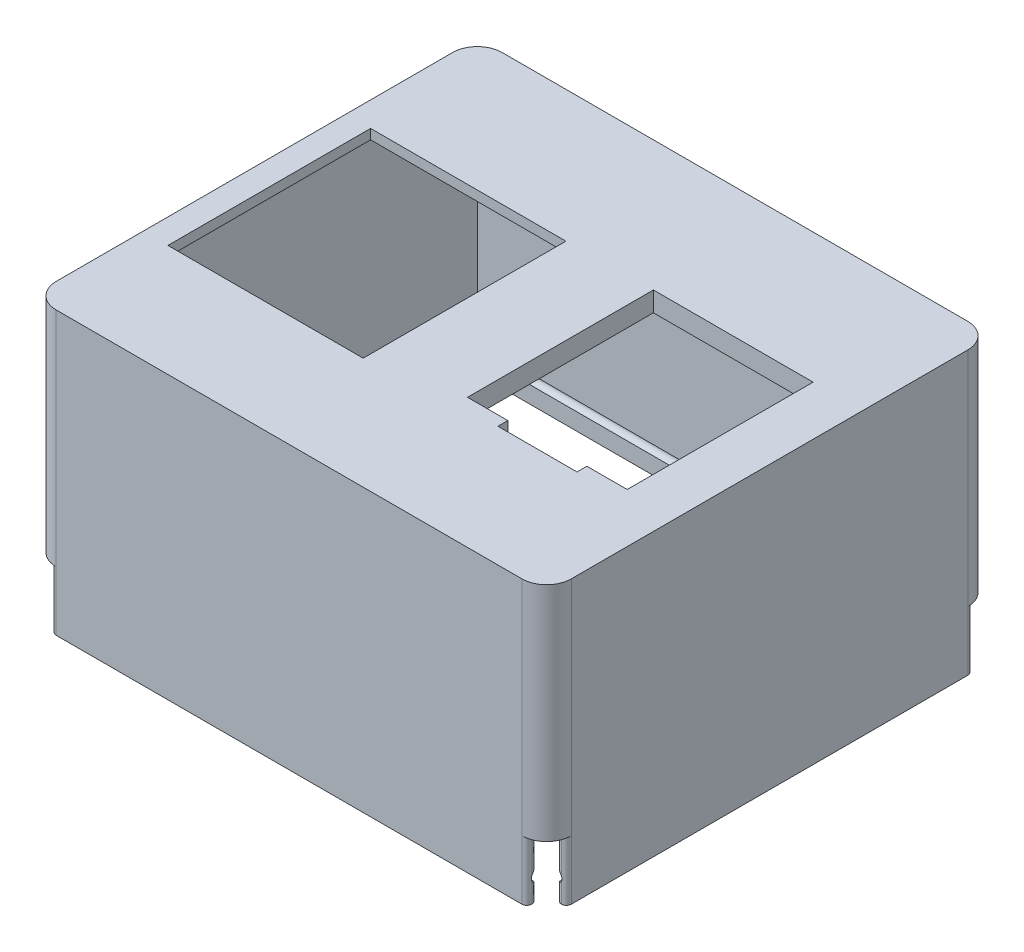
from build123d import *

# Parameters (mm, degrees)
ESQUISSE1_W                     = 104.2
ESQUISSE1_H                     = 90.2
BOSS_EXTRU_1_DEPTH              = 2
ESQUISSE2_W                     = 104.2
ESQUISSE2_H                     = 90.2
ESQUISSE2_W_2                   = 100.2
ESQUISSE2_H_2                   = 86.2
BOSS_EXTRU_2_DEPTH              = 55
ENL_V_MAT_EXTRU_1_DEPTH         = 12
SYM_TRIE2_COPY_1_DEPTH          = 12
CONG_3_R                        = 1
CONG_1_R                        = 5
ENL_V_MAT_EXTRU_2_DEPTH         = 89.167000629
ENL_V_MAT_EXTRU_3_DEPTH         = 89.167000741
ESQUISSE8_W                     = 32.3
ESQUISSE8_H                     = 37.6
ENL_V_MAT_EXTRU_6_DEPTH         = 3
ESQUISSE9_W                     = 44.3
ESQUISSE9_H                     = 49.6
ESQUISSE9_W_2                   = 32.3
ESQUISSE9_H_2                   = 37.6
BOSS_EXTRU_3_DEPTH              = 2
ESQUISSE10_W                    = 16
ESQUISSE10_H                    = 2
ENL_V_MAT_EXTRU_7_DEPTH         = 90.428295469
ESQUISSE13_R                    = 0.75
ENL_V_MAT_EXTRU_9_DEPTH         = 3
BOSS_EXTRU_4_DEPTH              = 2
ESQUISSE15_W                    = 100.6
ESQUISSE15_H                    = 86.6
ENL_V_MAT_EXTRU_10_DEPTH        = 4.5
ENL_V_MAT_EXTRU_12_REACH        = 90.167
ESQUISSE17_W                    = 39.5
ESQUISSE17_H                    = 41
ESQUISSE19_R                    = 4
BOSS_EXTRU_5_DEPTH              = 9
ESQUISSE20_R                    = 2.05
ENL_V_MAT_EXTRU_13_DEPTH        = 10
R_P_TITION_LIN_AIRE1_COUNT      = 2
R_P_TITION_LIN_AIRE1_PITCH      = 31.8
R_P_TITION_LIN_AIRE1_COUNT_DIR2 = 2
R_P_TITION_LIN_AIRE1_PITCH_DIR2 = 71.5


with BuildPart() as part:
    # Esquisse1 → Boss.-Extru.1 (new body)
    with BuildSketch(Plane(origin=(0, 0, 0), x_dir=(1, 0, 0), z_dir=(0, 1, 0))):
        Rectangle(ESQUISSE1_W, ESQUISSE1_H)
    extrude(amount=BOSS_EXTRU_1_DEPTH)

    # Esquisse2 → Boss.-Extru.2 (add)
    with BuildSketch(Plane.XZ):
        Rectangle(ESQUISSE2_W, ESQUISSE2_H)
        Rectangle(ESQUISSE2_W_2, ESQUISSE2_H_2, mode=Mode.SUBTRACT)
    extrude(amount=BOSS_EXTRU_2_DEPTH)

    # Esquisse3 → Enlèv. mat.-Extru.1 (cut)
    with BuildSketch(Plane.XZ.offset(55)):
        Polygon((-50.1, 41.1), (-50.1, 43.1), (-48.1, 43.1), (-48.1, 45.1), (-52.1, 45.1), (-52.1, 41.1), align=None)
    enl_v_mat_extru_1 = extrude(amount=-ENL_V_MAT_EXTRU_1_DEPTH, mode=Mode.SUBTRACT)

    # Symétrie1: Enlèv. mat.-Extru.1 across plane
    add(enl_v_mat_extru_1.mirror(Plane.XY), mode=Mode.SUBTRACT)

    # Symétrie2: Enlèv. mat.-Extru.1 across plane
    add(enl_v_mat_extru_1.mirror(Plane(origin=(0, 0, 0), x_dir=(0, 0, 1), z_dir=(1, 0, 0))), mode=Mode.SUBTRACT)

    # Symétrie2 copy 1 sketch → Symétrie2 copy 1 (cut)
    with BuildSketch(Plane(origin=(0, -55, 0), x_dir=(-1, 0, 0), z_dir=(0, -1, 0))):
        Polygon((-50.1, 41.1), (-50.1, 43.1), (-48.1, 43.1), (-48.1, 45.1), (-52.1, 45.1), (-52.1, 41.1), align=None)
    extrude(amount=-SYM_TRIE2_COPY_1_DEPTH, mode=Mode.SUBTRACT)

    # Congé3
    cong_3_edges = [part.edges().sort_by_distance(p)[0] for p in [
        (-48.1, -49, 45.1),
        (-48.1, -49, 43.1),
        (-50.1, -49, 41.1),
        (-52.1, -49, 41.1),
        (48.1, -49, 45.1),
        (48.1, -49, 43.1),
        (52.1, -49, 41.1),
        (50.1, -49, 41.1),
        (52.1, -49, -41.1),
        (50.1, -49, -41.1),
        (48.1, -49, -43.1),
        (48.1, -49, -45.1),
        (-48.1, -49, -45.1),
        (-48.1, -49, -43.1),
        (-50.1, -49, -41.1),
        (-52.1, -49, -41.1),
    ]]
    fillet(cong_3_edges, radius=CONG_3_R - 0.0001)  # a hair under: the kernel refuses the full size

    # Congé1
    cong_1_edges = [part.edges().sort_by_distance(p)[0] for p in [
        (52.1, -20.5, 45.1),
        (52.1, -20.5, -45.1),
        (-52.1, -20.5, -45.1),
        (-52.1, -20.5, 45.1),
    ]]
    fillet(cong_1_edges, radius=CONG_1_R)

    # Esquisse4 → Enlèv. mat.-Extru.2 (cut, symmetric)
    with BuildSketch(Plane(origin=(0, 0, 0), x_dir=(0, 0, -1), z_dir=(1, 0, 0))):
        with BuildLine():
            Line((-43.1, -49.4), (-43.1, -51.6))
            ThreePointArc((-43.1, -51.6), (-44.2, -50.5), (-43.1, -49.4))
        make_face()
    enl_v_mat_extru_2 = extrude(amount=ENL_V_MAT_EXTRU_2_DEPTH, both=True, mode=Mode.SUBTRACT)

    # Symétrie4: Enlèv. mat.-Extru.2 across plane
    add(enl_v_mat_extru_2.mirror(Plane.XY), mode=Mode.SUBTRACT)

    # Esquisse5 → Enlèv. mat.-Extru.3 (cut, symmetric)
    with BuildSketch(Plane.XY):
        with BuildLine():
            Line((-50.1, -49.4), (-50.1, -51.6))
            ThreePointArc((-50.1, -51.6), (-51.2, -50.5), (-50.1, -49.4))
        make_face()
    enl_v_mat_extru_3 = extrude(amount=ENL_V_MAT_EXTRU_3_DEPTH, both=True, mode=Mode.SUBTRACT)

    # Symétrie5: Enlèv. mat.-Extru.3 across plane
    add(enl_v_mat_extru_3.mirror(Plane(origin=(0, 0, 0), x_dir=(0, 0, 1), z_dir=(1, 0, 0))), mode=Mode.SUBTRACT)

    # Esquisse8 → Enlèv. mat.-Extru.6 (cut)
    with BuildSketch(Plane(origin=(0, 2, 0), x_dir=(1, 0, 0), z_dir=(0, 1, 0))):
        with Locations((25.95, 0)):
            Rectangle(ESQUISSE8_W, ESQUISSE8_H)
    extrude(amount=-ENL_V_MAT_EXTRU_6_DEPTH, mode=Mode.SUBTRACT)

    # Esquisse9 → Boss.-Extru.3 (add)
    with BuildSketch(Plane.XZ):
        with Locations((25.95, 0)):
            Rectangle(ESQUISSE9_W, ESQUISSE9_H)
        with Locations((25.95, 0)):
            Rectangle(ESQUISSE9_W_2, ESQUISSE9_H_2, mode=Mode.SUBTRACT)
    extrude(amount=BOSS_EXTRU_3_DEPTH)

    # Esquisse10 → Enlèv. mat.-Extru.7 (cut, through all)
    with BuildSketch(Plane(origin=(0, 2, 0), x_dir=(1, 0, 0), z_dir=(0, 1, 0))):
        with Locations((25.95, -19.8)):
            Rectangle(ESQUISSE10_W, ESQUISSE10_H)
    extrude(amount=-ENL_V_MAT_EXTRU_7_DEPTH, mode=Mode.SUBTRACT)

    # Esquisse13 → Enlèv. mat.-Extru.9 (cut)
    with BuildSketch(Plane.XZ.offset(2)):
        with Locations(Location((45.3, -10.8, 0), (0, 0, 270))):
            Circle(ESQUISSE13_R)
        with Locations(Location((5.2, 9.2, 0), (0, 0, 270))):
            Circle(ESQUISSE13_R)
        with Locations(Location((15.6, -21.4, 0), (0, 0, 270))):
            Circle(ESQUISSE13_R)
    extrude(amount=-ENL_V_MAT_EXTRU_9_DEPTH, mode=Mode.SUBTRACT)

    # Esquisse14 → Boss.-Extru.4 (add)
    with BuildSketch(Plane.XZ.offset(2)):
        with BuildLine():
            Line((3.8, 11.39089023), (3.8, 7.00910977))
            ThreePointArc((3.8, 7.00910977), (2.6, 9.2), (3.8, 11.39089023))
        make_face()
    extrude(amount=-BOSS_EXTRU_4_DEPTH)

    # Esquisse15 → Enlèv. mat.-Extru.10 (cut)
    with BuildSketch(Plane.XZ.offset(55)):
        Rectangle(ESQUISSE15_W, ESQUISSE15_H)
    extrude(amount=-ENL_V_MAT_EXTRU_10_DEPTH, mode=Mode.SUBTRACT)

    # Esquisse17 → Enlèv. mat.-Extru.12 (cut, up to next)
    with BuildSketch(Plane.XZ, mode=Mode.PRIVATE) as enl_v_mat_extru_12_sk1:
        with Locations((-27.35, 2)):
            Rectangle(ESQUISSE17_W, ESQUISSE17_H)
    enl_v_mat_extru_12_tool1 = extrude(enl_v_mat_extru_12_sk1.sketch, amount=-ENL_V_MAT_EXTRU_12_REACH, mode=Mode.PRIVATE) & part.part
    add(enl_v_mat_extru_12_tool1.solids().sort_by_distance((-27.35, 0, 2))[0], mode=Mode.SUBTRACT)

    # Esquisse19 → Boss.-Extru.5 (add)
    with BuildSketch(Plane.XZ):
        with Locations(Location((-44.1, 32.5, 0), (0, 0, 270))):
            Circle(ESQUISSE19_R)
        with Locations(Location((-44.1, -39, 0), (0, 0, 270))):
            Circle(ESQUISSE19_R)
        with Locations(Location((-12.3, 32.5, 0), (0, 0, 270))):
            Circle(ESQUISSE19_R)
        with Locations(Location((-12.3, -39, 0), (0, 0, 270))):
            Circle(ESQUISSE19_R)
    extrude(amount=BOSS_EXTRU_5_DEPTH)

    # Esquisse20 → Enlèv. mat.-Extru.13 (cut)
    with BuildSketch(Plane.XZ.offset(9)):
        with Locations(Location((-44.1, 32.5, 0), (0, 0, 270))):
            Circle(ESQUISSE20_R)
    enl_v_mat_extru_13 = extrude(amount=-ENL_V_MAT_EXTRU_13_DEPTH, mode=Mode.SUBTRACT)

    # Répétition linéaire1: Enl_v. mat.-Extru.13 2 × 2
    with Locations(*[(i * R_P_TITION_LIN_AIRE1_PITCH, 0, -j * R_P_TITION_LIN_AIRE1_PITCH_DIR2) for i in range(R_P_TITION_LIN_AIRE1_COUNT) for j in range(R_P_TITION_LIN_AIRE1_COUNT_DIR2) if (i, j) != (0, 0)]):
        add(enl_v_mat_extru_13, mode=Mode.SUBTRACT)


solid = part.part
